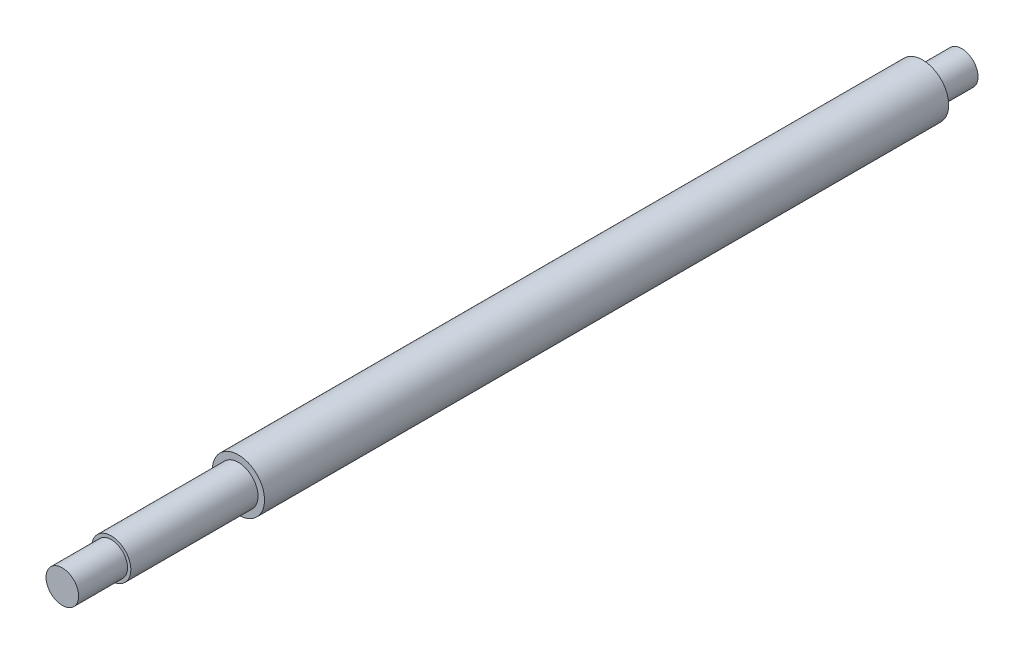
from build123d import *


with BuildPart() as part:
    # Sketch1 → Revolve1 (revolve)
    with BuildSketch(Plane(origin=(0, 0, 0), x_dir=(0, 0, -1), z_dir=(1, 0, 0))):
        Polygon((-275.75, 0), (-275.75, 5), (-260.75, 5), (-260.75, 6), (-221.75, 6), (-221.75, 8), (-12, 8), (-12, 5), (0, 5), (0, 0), align=None)
    revolve(axis=Axis((0, 0, 0), (0, 0, 1)))


solid = part.part
